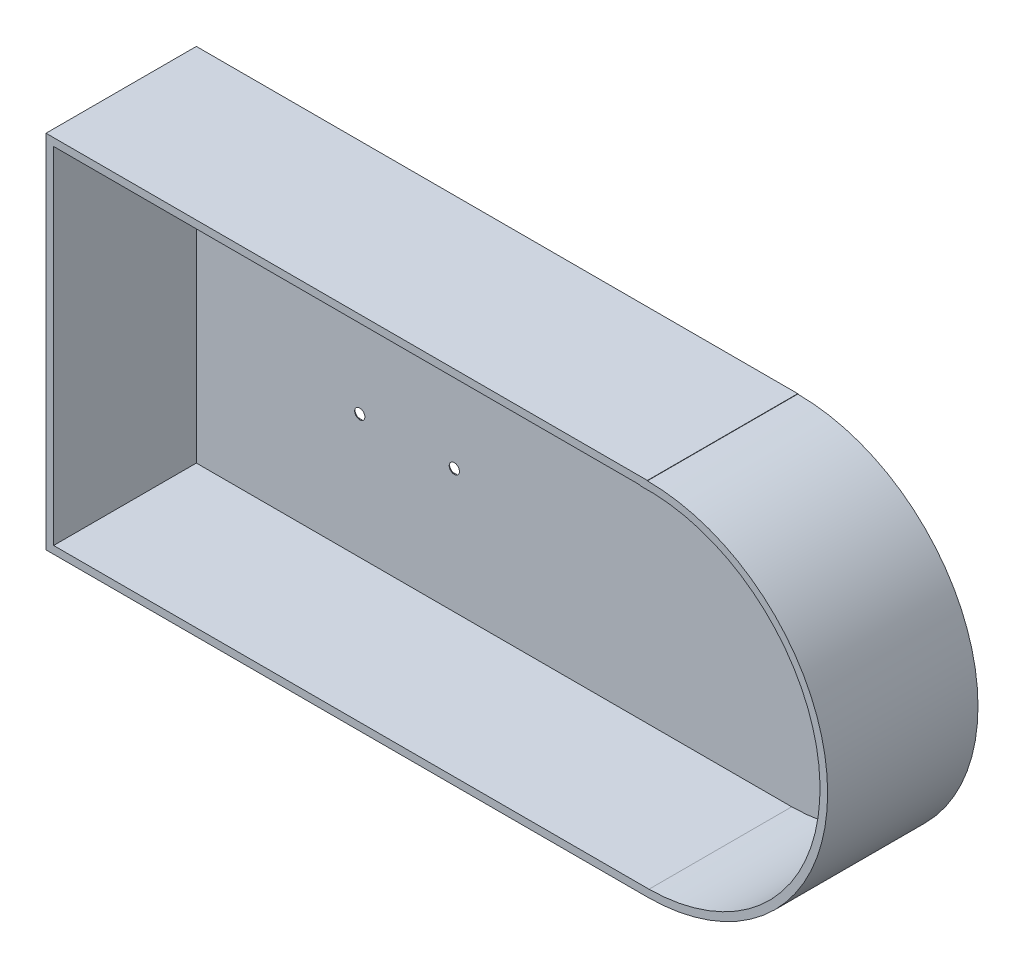
from build123d import *

# Parameters (mm, degrees)
BOSS_EXTRUDE1_DEPTH            = 50
SHELL1_START                   = 2.54
SHELL1_DEPTH                   = 47.46
SKETCH3_R                      = 45
CUT_EXTRUDE1_DEPTH             = 1.74
SKETCH4_W                      = 40
SKETCH4_H                      = 40
CUT_EXTRUDE2_DEPTH             = 1.74
F_1_0MM_DOWEL_HOLE1_AT_2_COUNT = 2
F_1_0MM_DOWEL_HOLE1_AT_2_PITCH = 99.87910309
F_1_0MM_DOWEL_HOLE1_AT_3_COUNT = 2
F_1_0MM_DOWEL_HOLE1_AT_3_PITCH = 131.082783866
F_1_0MM_DOWEL_HOLE1_AT_4_COUNT = 2
F_1_0MM_DOWEL_HOLE1_AT_4_PITCH = 131.419090104
F_1_0MM_DOWEL_HOLE1_AT_5_COUNT = 2
F_1_0MM_DOWEL_HOLE1_AT_5_PITCH = 100.320069037


# Read off the part's stored shape, not the designer's step: Shell1
with BuildPart() as part:
    # Sketch2 → Boss-Extrude1 (new body)
    with BuildSketch(Plane.XY):
        with BuildLine():
            Line((-59.862068966, 43.445816391), (-59.862068966, 43.448275862))
            Line((-59.862068966, 43.448275862), (-259.862068966, 43.448275862))
            Line((-259.862068966, 43.448275862), (-259.862068966, 163.448275862))
            Line((-259.862068966, 163.448275862), (-59.862068966, 163.448275862))
            Line((-59.862068966, 163.448275862), (-59.862068966, 163.328859089))
            ThreePointArc((-59.862068966, 163.328859089), (0.079347122, 103.38733774), (-59.862068966, 43.445816391))
        make_face()
    extrude(amount=BOSS_EXTRUDE1_DEPTH)

    # Shell1 outline → Shell1 (cut)
    with BuildSketch(Plane.XY.offset(SHELL1_START)):
        with BuildLine():
            Line((-257.322068966, 160.908275862), (-257.322068966, 45.988275862))
            Line((-257.322068966, 45.988275862), (-59.330809241, 45.988275862))
            ThreePointArc((-59.330809241, 45.988275862), (-2.481203762, 104.923202846), (-62.402068966, 160.732639099))
            Line((-62.402068966, 160.732639099), (-62.402068966, 160.908275862))
            Line((-62.402068966, 160.908275862), (-257.322068966, 160.908275862))
        make_face()
    extrude(amount=SHELL1_DEPTH, mode=Mode.SUBTRACT)

    # Sketch3 → Cut-Extrude1 (cut)
    with BuildSketch(Plane(origin=(0, 0, 0), x_dir=(-1, 0, 0), z_dir=(0, 0, -1))):
        with Locations((75.49891969, 103.730340091)):
            Circle(SKETCH3_R)
    extrude(amount=-CUT_EXTRUDE1_DEPTH, mode=Mode.SUBTRACT)

    # Sketch4 → Cut-Extrude2 (cut)
    with BuildSketch(Plane(origin=(0, 0, 0), x_dir=(-1, 0, 0), z_dir=(0, 0, -1))):
        with Locations((187.286164269, 103.448275862)):
            Rectangle(SKETCH4_W, SKETCH4_H)
    extrude(amount=-CUT_EXTRUDE2_DEPTH, mode=Mode.SUBTRACT)

    # Sketch8 → Ø1.0mm Dowel Hole1 (revolve, cut)
    with BuildSketch(Plane(origin=(-72.665980043, 104.296928021, 1.74), x_dir=(0, 1, 0), z_dir=(1, 0, 0))):
        Polygon((0, 0), (0, 1.57043031), (0.5, 1.27), (0.5, 2), (2.5, 0), align=None)
    f_1_0mm_dowel_hole1 = revolve(axis=Axis((-72.665980043, 104.296928021, -4.61), (0, 0, 1)), mode=Mode.SUBTRACT)

    # Ø1.0mm Dowel Hole1 at 2: Ø1.0mm Dowel Hole1 ×2
    with Locations(*[Vector(-0.9898926866452568, 0.1418184364821284, 0) * (i * F_1_0MM_DOWEL_HOLE1_AT_2_PITCH) for i in range(1, F_1_0MM_DOWEL_HOLE1_AT_2_COUNT)]):
        add(f_1_0mm_dowel_hole1, mode=Mode.SUBTRACT)

    # Ø1.0mm Dowel Hole1 at 3: Ø1.0mm Dowel Hole1 ×2
    with Locations(*[Vector(-0.9941444630694566, 0.10805918076841914, 0) * (i * F_1_0MM_DOWEL_HOLE1_AT_3_PITCH) for i in range(1, F_1_0MM_DOWEL_HOLE1_AT_3_COUNT)]):
        add(f_1_0mm_dowel_hole1, mode=Mode.SUBTRACT)

    # Ø1.0mm Dowel Hole1 at 4: Ø1.0mm Dowel Hole1 ×2
    with Locations(*[Vector(-0.9916004111862218, -0.12933918406776793, 0) * (i * F_1_0MM_DOWEL_HOLE1_AT_4_PITCH) for i in range(1, F_1_0MM_DOWEL_HOLE1_AT_4_COUNT)]):
        add(f_1_0mm_dowel_hole1, mode=Mode.SUBTRACT)

    # Ø1.0mm Dowel Hole1 at 5: Ø1.0mm Dowel Hole1 ×2
    with Locations(*[Vector(-0.9855415237113911, -0.16943407284436512, 0) * (i * F_1_0MM_DOWEL_HOLE1_AT_5_PITCH) for i in range(1, F_1_0MM_DOWEL_HOLE1_AT_5_COUNT)]):
        add(f_1_0mm_dowel_hole1, mode=Mode.SUBTRACT)


solid = part.part
